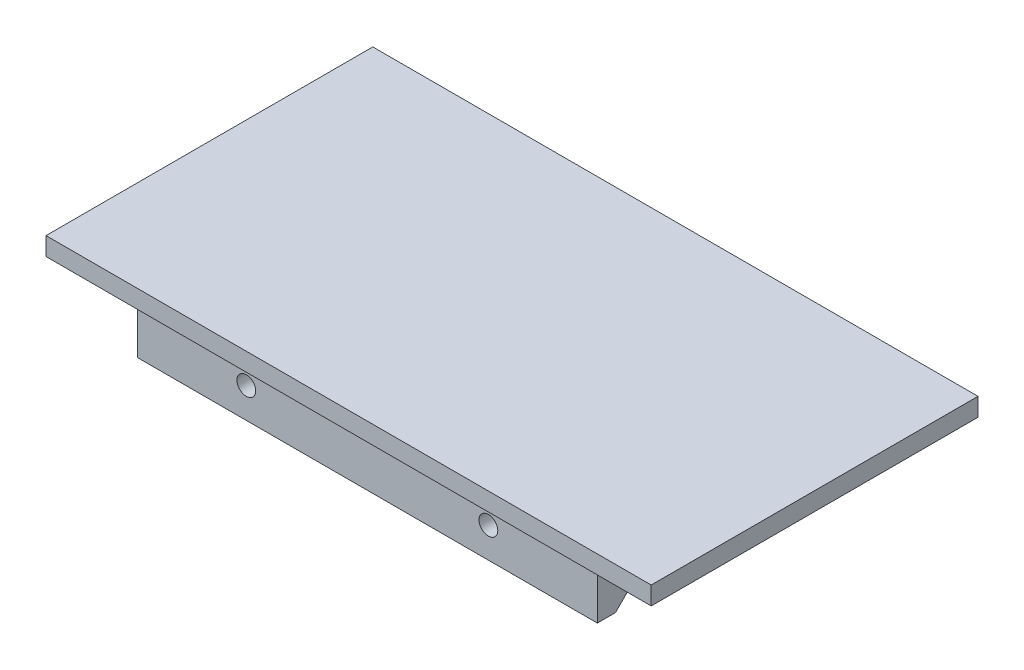
from build123d import *

# Parameters (mm, degrees)
SKETCH1_W           = 100
SKETCH1_H           = 54
BOSS_EXTRUDE1_DEPTH = 3
SKETCH2_W           = 76
SKETCH2_H           = 3
BOSS_EXTRUDE2_DEPTH = 10
CHAMFER1_SIZE       = 10
SKETCH3_W           = 10
SKETCH3_H           = 10
CUT_EXTRUDE1_DEPTH  = 10
SKETCH4_R           = 1.55
CUT_EXTRUDE2_DEPTH  = 3


with BuildPart() as part:
    # Sketch1 → Boss-Extrude1 (new body)
    with BuildSketch(Plane(origin=(0, 0, 0), x_dir=(1, 0, 0), z_dir=(0, 1, 0))):
        Rectangle(SKETCH1_W, SKETCH1_H)
    extrude(amount=BOSS_EXTRUDE1_DEPTH)

    # Sketch2 → Boss-Extrude2 (add)
    with BuildSketch(Plane.XZ):
        with Locations((0, 22.4)):
            Rectangle(SKETCH2_W, SKETCH2_H)
        with Locations((0, -22.4)):
            Rectangle(SKETCH2_W, SKETCH2_H)
    extrude(amount=BOSS_EXTRUDE2_DEPTH)

    # Chamfer1
    chamfer1_edges = [part.edges().sort_by_distance(p)[0] for p in [
        (0, 0, -20.9),
        (0, 0, 20.9),
    ]]
    chamfer(chamfer1_edges, length=CHAMFER1_SIZE - 0.0001)  # a hair under: the kernel refuses the full size

    # Sketch3 → Cut-Extrude1 (cut)
    with BuildSketch(Plane.XZ.offset(10)):
        with Locations((-20, 15.9)):
            Rectangle(SKETCH3_W, SKETCH3_H)
        with Locations((20, 15.9)):
            Rectangle(SKETCH3_W, SKETCH3_H)
    extrude(amount=-CUT_EXTRUDE1_DEPTH, mode=Mode.SUBTRACT)

    # Sketch4 → Cut-Extrude2 (cut)
    with BuildSketch(Plane.XY.offset(23.9)):
        with Locations((-20, -5)):
            Circle(SKETCH4_R)
        with Locations((20, -5)):
            Circle(SKETCH4_R)
    extrude(amount=-CUT_EXTRUDE2_DEPTH, mode=Mode.SUBTRACT)


solid = part.part
